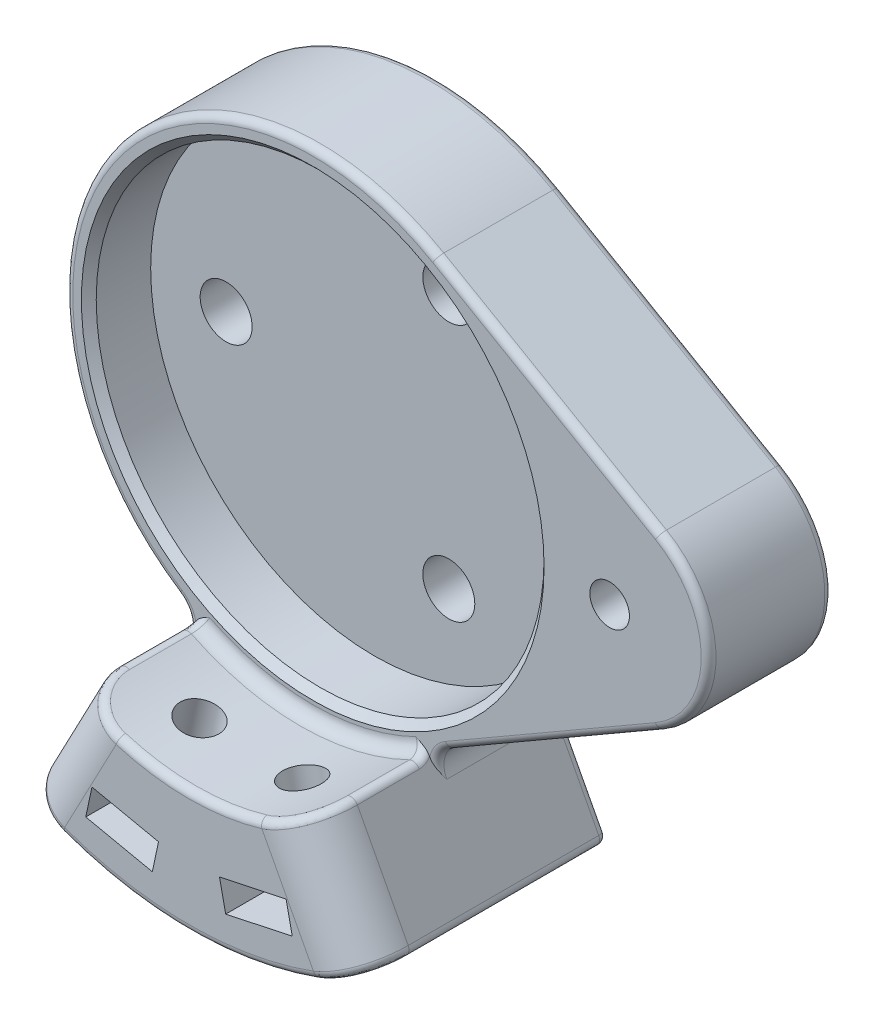
from build123d import *

# Parameters (mm, degrees)
BOSS_EXTRU_1_DEPTH           = 10
ESQUISSE2_R                  = 18.1
ENL_V_MAT_EXTRU_1_DEPTH      = 5
ESQUISSE3_R                  = 2.1
ENL_V_MAT_EXTRU_2_DEPTH      = 39.065732621
R_P_TITION_CIRCULAIRE1_COUNT = 3
ESQUISSE4_R                  = 1.6
ENL_V_MAT_EXTRU_3_DEPTH      = 40.038442592
ESQUISSE5_R                  = 4
ENL_V_MAT_EXTRU_4_DEPTH      = 7
BOSS_EXTRU_2_DEPTH           = 20
CONG_5_R                     = 4
CONG_2_R                     = 2
CONG_4_R                     = 1
ESQUISSE8_R                  = 1.6
ENL_V_MAT_EXTRU_5_DEPTH      = 49.207883276
ENL_V_START                  = -26
ENL_V_MAT_EXTRU_6_DEPTH      = 1.2
CONG_1_R                     = 0.6
CHANFREIN1_SIZE              = 0.6


with BuildPart() as part:
    # Esquisse1 → Boss.-Extru.1 (new body)
    with BuildSketch(Plane.XY):
        with BuildLine():
            Line((10, 17.320508076), (28, 6.92820323))
            ThreePointArc((28, 6.92820323), (32, 0), (28, -6.92820323))
            Line((28, -6.92820323), (10, -17.320508076))
            ThreePointArc((10, -17.320508076), (-20, 0), (10, 17.320508076))
        make_face()
    extrude(amount=BOSS_EXTRU_1_DEPTH)

    # Esquisse2 → Enlèv. mat.-Extru.1 (cut)
    with BuildSketch(Plane.XY.offset(10)):
        Circle(ESQUISSE2_R)
    extrude(amount=-ENL_V_MAT_EXTRU_1_DEPTH, mode=Mode.SUBTRACT)

    # Esquisse3 → Enlèv. mat.-Extru.2 (cut, through all)
    with BuildSketch(Plane.XY.offset(5)):
        with Locations((-12, 0)):
            Circle(ESQUISSE3_R)
    enl_v_mat_extru_2 = extrude(amount=-ENL_V_MAT_EXTRU_2_DEPTH, mode=Mode.SUBTRACT)

    # Répétition circulaire1: Enlèv. mat.-Extru.2 ×3 about axis
    r_p_tition_circulaire1_axis = Axis((0, 0, 0), (0, 0, 1))
    for i in range(1, R_P_TITION_CIRCULAIRE1_COUNT):
        add(enl_v_mat_extru_2.rotate(r_p_tition_circulaire1_axis, i * 360 / R_P_TITION_CIRCULAIRE1_COUNT), mode=Mode.SUBTRACT)

    # Esquisse4 → Enlèv. mat.-Extru.3 (cut, through all)
    with BuildSketch(Plane.XY.offset(10)):
        with Locations((24, 0)):
            Circle(ESQUISSE4_R)
    extrude(amount=-ENL_V_MAT_EXTRU_3_DEPTH, mode=Mode.SUBTRACT)

    # Esquisse5 → Enlèv. mat.-Extru.4 (cut)
    with BuildSketch(Plane(origin=(0, 0, 0), x_dir=(-1, 0, 0), z_dir=(0, 0, -1))):
        with Locations((-24, 0)):
            Circle(ESQUISSE5_R)
    extrude(amount=-ENL_V_MAT_EXTRU_4_DEPTH, mode=Mode.SUBTRACT)

    # Esquisse7 → Boss.-Extru.2 (add)
    with BuildSketch(Plane(origin=(0, 0, 0), x_dir=(-1, 0, 0), z_dir=(0, 0, -1))):
        with BuildLine():
            Line((9.333333333, -17.688665549), (14, -26.532998323))
            ThreePointArc((14, -26.532998323), (0, -30), (-14, -26.532998323))
            Line((-14, -26.532998323), (-9.333333333, -17.688665549))
            ThreePointArc((-9.333333333, -17.688665549), (0, -20), (9.333333333, -17.688665549))
        make_face()
    extrude(amount=-BOSS_EXTRU_2_DEPTH)

    # Congé5
    cong_5_edges = [part.edges().sort_by_distance(p)[0] for p in [
        (-11.666666667, -22.110831936, 20),
        (11.666666667, -22.110831936, 20),
    ]]
    fillet(cong_5_edges, radius=CONG_5_R)

    # Congé2
    # the kernel refuses this fillet: 2 mm, written as the material it adds along each edge
    with BuildSketch(Plane(origin=(-9.333333333, -17.688665549, 0), x_dir=(-0.46666666666666545, -0.8844332774281073, 0), z_dir=(0, 0, 1))) as cong_2_piece_1:
        with BuildLine():
            CenterArc((1.9089023, -2), CONG_2_R, 90, 84.78409143)
            ThreePointArc((-0.082816091, -1.818181818), (-0.02071475, -0.910033465), (0, 0))
            Line((0, 0), (1.9089023, 0))
        make_face()
    extrude(amount=10)
    with BuildSketch(Plane(origin=(9.333333333, -17.688665549, 0), x_dir=(0.46666666666666606, -0.884433277428107, 0), z_dir=(0, 0, 1))) as cong_2_piece_2:
        with BuildLine():
            CenterArc((1.939762999, 2), CONG_2_R, 182.181860715, 87.818139285)
            Line((-0.05878704, 1.923857099), (-0.258642044, 1.916242809))
            ThreePointArc((-0.258642044, 1.916242809), (-0.214354613, 0.753814716), (-0.2, 0))
            Line((-0.2, 0), (0, -0.2))
            Line((0, -0.2), (1.939762999, -0.2))
            Line((1.939762999, -0.2), (1.939762999, 0))
        make_face()
    extrude(amount=10)

    # Congé4
    cong_4_edges = [part.edges().sort_by_distance(p)[0] for p in [
        (0, -20, 10),
    ]]
    fillet(cong_4_edges, radius=CONG_4_R)

    # Esquisse8 → Enlèv. mat.-Extru.5 (cut, through all)
    with BuildSketch(Plane(origin=(0, 0, 0), x_dir=(0, 0, 1), z_dir=(-0.20791169081776326, 0.9781476007338048, 0))):
        with Locations(Location((15, 0, 0), (0, 0, 270))):
            Circle(ESQUISSE8_R)
    enl_v_mat_extru_5 = extrude(amount=-ENL_V_MAT_EXTRU_5_DEPTH, mode=Mode.SUBTRACT)

    # Esquisse9 → Enlèv. mat.-Extru.6 (cut, symmetric)
    with BuildSketch(Plane(origin=(0, 0, 0), x_dir=(0, 0, 1), z_dir=(-0.20791169081776326, 0.9781476007338048, 0)).offset(ENL_V_START)):
        Polygon((16.58771324, 2.75), (20, 2.75), (20, -2.75), (16.58771324, -2.75), (13.41228676, -2.75), (11.824573519, 0), (13.41228676, 2.75), align=None)
    enl_v_mat_extru_6 = extrude(amount=ENL_V_MAT_EXTRU_6_DEPTH, both=True, mode=Mode.SUBTRACT)

    # Symétrie1: Enlèv. mat.-Extru.5, Enlèv. mat.-Extru.6 across plane
    add(enl_v_mat_extru_5.mirror(Plane(origin=(0, 0, 0), x_dir=(0, 0, 1), z_dir=(1, 0, 0))), mode=Mode.SUBTRACT)
    add(enl_v_mat_extru_6.mirror(Plane(origin=(0, 0, 0), x_dir=(0, 0, 1), z_dir=(1, 0, 0))), mode=Mode.SUBTRACT)

    # Congé1
    cong_1_edges = [part.edges().sort_by_distance(p)[0] for p in [
        (32, 0, 10),
        (19, 12.124355653, 10),
        (0, -30, 0),
        (-12.112077203, -22.954980295, 0),
        (-17.049697601, 10.455037623, 10),
        (19, 12.124355653, 0),
        (32, 0, 0),
        (0, -30, 20),
        (-17.049697601, 10.455037623, 0),
        (0, -20, 20),
        (19.503711311, -11.833537792, 0),
        (19.503711311, -11.833537792, 10),
        (12.119278033, -22.968627409, 0),
        (-10.057373227, -17.940371694, 0),
        (-10.057373227, -17.940371694, 10),
        (10.085776542, -17.916598035, 0),
        (10.085776542, -17.916598035, 10),
    ]]
    fillet(cong_1_edges, radius=CONG_1_R)

    # Chanfrein1
    chanfrein1_edges = [part.edges().sort_by_distance(p)[0] for p in [
        (-18.1, 0, 10),
    ]]
    chamfer(chanfrein1_edges, length=CHANFREIN1_SIZE)


solid = part.part
